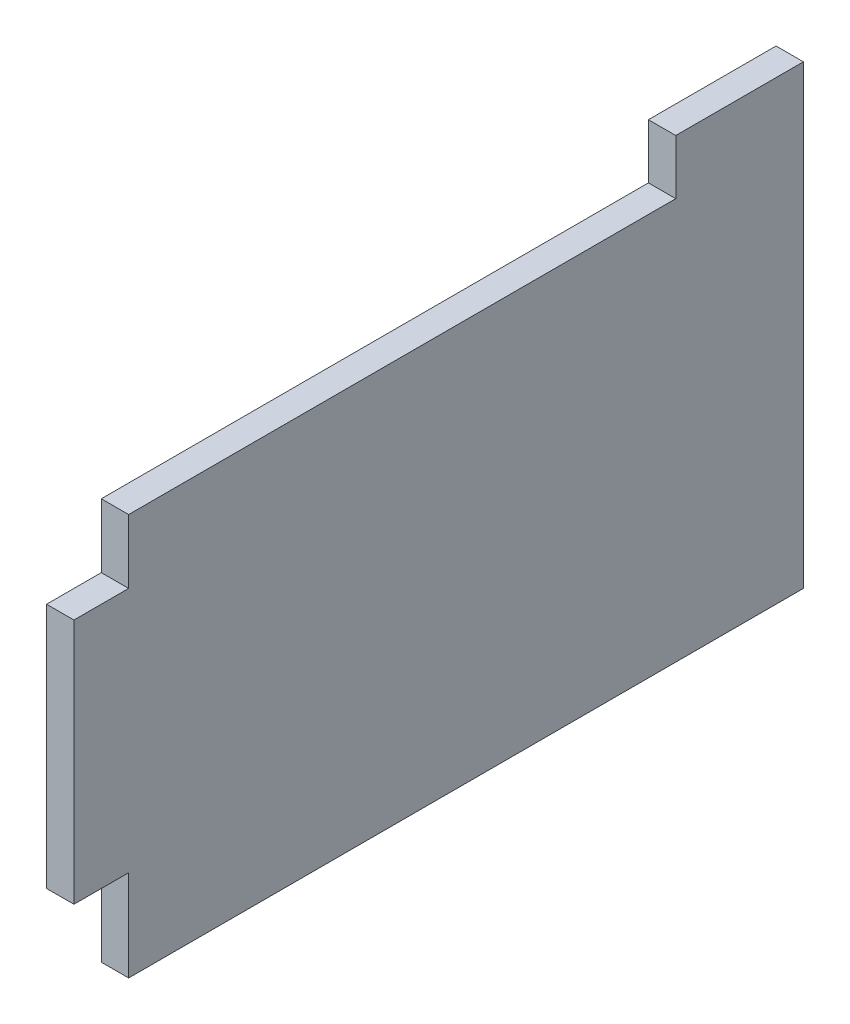
from build123d import *

# Parameters (mm, degrees)
BOSS_EXTRUDE1_DEPTH     = 3
CUT_EXTRUDE1_DEPTH      = 10
CUT_EXTRUDE1_DEPTH_BACK = 10


with BuildPart() as part:
    # Sketch2 → Boss-Extrude1 (new body)
    with BuildSketch(Plane(origin=(0, 0, 0), x_dir=(0, 0, -1), z_dir=(1, 0, 0))):
        Polygon((63, 3.015400021), (103, 3.015400021), (103, -2.984599979), (159.781661072, -2.984599979), (159.781661072, -10), (165.781661072, -10), (165.781661072, -37), (159.781661072, -37), (159.781661072, -47), (3, -47), (3, -37), (-3, -37), (-3, -10), (3, -10), (3, -2.984599979), (63, -2.984599979), align=None)
    extrude(amount=BOSS_EXTRUDE1_DEPTH)

    # Sketch3 → Cut-Extrude1 (cut, two sides: drawn at the far end of the back side and taken through both)
    with BuildSketch(Plane(origin=(0, 0, 0), x_dir=(0, 0, -1), z_dir=(1, 0, 0)).offset(-CUT_EXTRUDE1_DEPTH_BACK)):
        Polygon((77, 4.594080923), (187.139354616, 4.594080923), (187.139354616, -56.777475016), (77, -56.777475016), (77, -46.986682045), align=None)
    extrude(amount=CUT_EXTRUDE1_DEPTH + CUT_EXTRUDE1_DEPTH_BACK, mode=Mode.SUBTRACT)


solid = part.part
